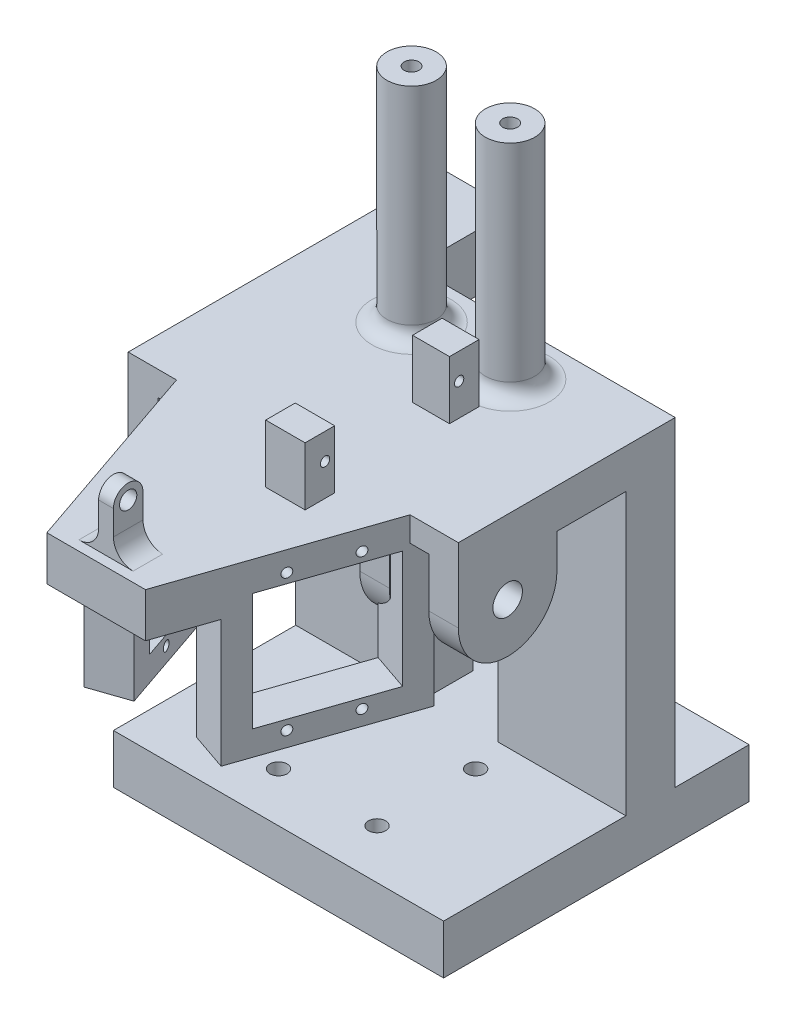
from build123d import *

# Parameters (mm, degrees)
SKETCH_1_W             = 67
SKETCH_1_H             = 62
EXTRUDE_1_DEPTH        = 10
SKETCH_3_W             = 14
SKETCH_3_H             = 20
EXTRUDE_2_DEPTH        = 12.5
SKETCH_4_W             = 10
SKETCH_4_H             = 65
EXTRUDE_3_DEPTH        = 67
SKETCH_5_W             = 67
SKETCH_5_H             = 44
EXTRUDE_4_DEPTH        = 8
EXTRUDE_5_DEPTH        = 20
CUT_EXTRUDE_START      = -6
CUT_EXTRUDE_1_DEPTH    = 8
EXTRUDE_6_DEPTH        = 6
SKETCH_9_R             = 3
CUT_EXTRUDE_2_DEPTH    = 23
SKETCH_10_W            = 24
SKETCH_10_H            = 23.8
EXTRUDE_7_DEPTH        = 8
SKETCH_12_W            = 14
SKETCH_12_H            = 20
EXTRUDE_8_DEPTH        = 11.5
SKETCH_13_R            = 0.95
CUT_EXTRUDE_4_DEPTH    = 8
SKETCH_14_W            = 7.5
SKETCH_14_H            = 6
SKETCH_14_W_2          = 8
EXTRUDE_9_DEPTH        = 11.8
SKETCH_15_R            = 0.95
CUT_EXTRUDE_5_DEPTH    = 11.8
SKETCH_16_W            = 3
SKETCH_16_H            = 6
EXTRUDE_10_DEPTH       = 12
FILLET_1_RADIUS        = 3
FILLET_1_LENGTH        = 3
SKETCH_17_R            = 1.75
CUT_EXTRUDE_6_DEPTH    = 7
SKETCH_18_R            = 5
EXTRUDE_11_DEPTH       = 45
FILLET_2_R             = 3
FILLET_2_OF_MIRROR_1_R = 3
SKETCH_20_R            = 1.75
CUT_EXTRUDE_7_DEPTH    = 35
SKETCH_21_W            = 15
SKETCH_21_H            = 55
CUT_EXTRUDE_8_DEPTH    = 35
SKETCH_24_R            = 1.75
CUT_EXTRUDE_11_DEPTH   = 18
SKETCH_25_R            = 1.5
CUT_EXTRUDE_12_DEPTH   = 10
FILLET_3_R             = 4
EXTRUDE_12_DEPTH       = 3
SKETCH_27_W            = 9.9
SKETCH_27_H            = 3.8
EXTRUDE_13_DEPTH       = 1
SKETCH_29_R            = 1.4
CUT_EXTRUDE_13_DEPTH   = 4


with BuildPart() as part:
    # 草图1 → 凸台-拉伸1 (new body)
    with BuildSketch(Plane(origin=(0, 0, 0), x_dir=(1, 0, 0), z_dir=(0, 1, 0))):
        Rectangle(SKETCH_1_W, SKETCH_1_H)
    extrude(amount=EXTRUDE_1_DEPTH)

    # 草图3 → 凸台-拉伸2 (add)
    with BuildSketch(Plane(origin=(0, 10, 0), x_dir=(1, 0, 0), z_dir=(0, 1, 0))):
        with Locations((-26.5, 26)):
            Rectangle(SKETCH_3_W, SKETCH_3_H)
    extrude(amount=EXTRUDE_2_DEPTH)

    # 草图4 → 凸台-拉伸3 (add)
    with BuildSketch(Plane.ZY.offset(33.5)):
        with Locations((-11, 42.5)):
            Rectangle(SKETCH_4_W, SKETCH_4_H)
    extrude(amount=-EXTRUDE_3_DEPTH)

    # 草图5 → 凸台-拉伸4 (add)
    with BuildSketch(Plane(origin=(0, 75, 0), x_dir=(1, 0, 0), z_dir=(0, 1, 0))):
        with Locations((0, -6)):
            Rectangle(SKETCH_5_W, SKETCH_5_H)
    extrude(amount=-EXTRUDE_4_DEPTH)

    # 草图6 → 凸台-拉伸5 (add)
    with BuildSketch(Plane(origin=(33.5, 0, 0), x_dir=(0, 0, -1), z_dir=(1, 0, 0))):
        with BuildLine():
            Line((-28, 60), (-28, 67))
            Line((-28, 67), (-8, 67))
            Line((-8, 67), (-8, 60))
            ThreePointArc((-8, 60), (-18, 50), (-28, 60))
        make_face()
    extrude_5 = extrude(amount=-EXTRUDE_5_DEPTH)

    # 草图7 → 切除-拉伸1 (cut)
    with BuildSketch(Plane(origin=(33.5, 0, 0), x_dir=(0, 0, -1), z_dir=(1, 0, 0)).offset(CUT_EXTRUDE_START)):
        with BuildLine():
            Line((-28, 60), (-28, 70.000230089))
            Line((-28, 70.000230089), (-8, 70.000230089))
            Line((-8, 70.000230089), (-8, 60))
            ThreePointArc((-8, 60), (-18, 50), (-28, 60))
        make_face()
    cut_extrude_1 = extrude(amount=-CUT_EXTRUDE_1_DEPTH, mode=Mode.SUBTRACT)

    # 草图8 → 凸台-拉伸6 (add)
    with BuildSketch(Plane(origin=(0, 75, 0), x_dir=(1, 0, 0), z_dir=(0, 1, 0))):
        Polygon((0, -68), (10, -68), (23.694211345, -28), (0, -28), align=None)
    extrude_6 = extrude(amount=-EXTRUDE_6_DEPTH)

    # 草图9 → 切除-拉伸2 (cut)
    with BuildSketch(Plane(origin=(33.5, 0, 0), x_dir=(0, 0, -1), z_dir=(1, 0, 0))):
        with Locations((-18, 60)):
            Circle(SKETCH_9_R)
    cut_extrude_2 = extrude(amount=-CUT_EXTRUDE_2_DEPTH, mode=Mode.SUBTRACT)

    # 草图10 → 凸台-拉伸7 (add)
    with BuildSketch(Plane(origin=(29.7887098, 0, 10.198322192), x_dir=(0.32389942978753467, 0, -0.9460915174460186), z_dir=(0.9460915174460186, 0, 0.32389942978753467))):
        Polygon((-44, 75), (-15, 75), (-15, 40.2), (-43, 40.2), (-49, 40.2), (-49, 75), align=None)
        with Locations((-32, 57.1)):
            Rectangle(SKETCH_10_W, SKETCH_10_H, mode=Mode.SUBTRACT)
    extrude_7 = extrude(amount=-EXTRUDE_7_DEPTH)

    # 草图12 → 凸台-拉伸8 (add)
    with BuildSketch(Plane(origin=(0, 75, 0), x_dir=(1, 0, 0), z_dir=(0, 1, 0))):
        with Locations((-26.5, 26)):
            Rectangle(SKETCH_12_W, SKETCH_12_H)
    extrude(amount=-EXTRUDE_8_DEPTH)

    # 草图13 → 切除-拉伸4 (cut)
    with BuildSketch(Plane(origin=(22.21997766, 0, 7.607126754), x_dir=(-0.3238994297875346, 0, 0.9460915174460185), z_dir=(-0.9460915174460185, 0, -0.3238994297875346))):
        with Locations((38.5, 70.95)):
            Circle(SKETCH_13_R)
        with Locations((26.5, 70.95)):
            Circle(SKETCH_13_R)
        with Locations((26.5, 43.25)):
            Circle(SKETCH_13_R)
        with Locations((38.5, 43.25)):
            Circle(SKETCH_13_R)
    cut_extrude_4 = extrude(amount=-CUT_EXTRUDE_4_DEPTH, mode=Mode.SUBTRACT)

    # 草图14 → 凸台-拉伸9 (add)
    with BuildSketch(Plane(origin=(0, 75, 0), x_dir=(1, 0, 0), z_dir=(0, 1, 0))):
        with Locations((7.95, -5)):
            Rectangle(SKETCH_14_W, SKETCH_14_H)
        with Locations((8.2, -34.8)):
            Rectangle(SKETCH_14_W_2, SKETCH_14_H)
    extrude(amount=EXTRUDE_9_DEPTH)

    # 草图15 → 切除-拉伸5 (cut)
    with BuildSketch(Plane.ZY.offset(-4.2)):
        with Locations((33.75, 81.5)):
            Circle(SKETCH_15_R)
        with Locations((6.05, 81.5)):
            Circle(SKETCH_15_R)
    extrude(amount=-CUT_EXTRUDE_5_DEPTH, mode=Mode.SUBTRACT)

    # 草图16 → 凸台-拉伸10 (add)
    with BuildSketch(Plane(origin=(0, 75, 0), x_dir=(1, 0, 0), z_dir=(0, 1, 0))):
        with Locations((0, -63)):
            Rectangle(SKETCH_16_W, SKETCH_16_H)
    extrude(amount=EXTRUDE_10_DEPTH)

    # 圆角1: full round fillet: the end face becomes a half cylinder, R = half its width
    fillet_1_face = Plane((0, 87, 63), x_dir=(1, 0, 0), z_dir=(0, 1, 0))  # on the end face: x along it, z out of the body
    fillet_1_slab = fillet_1_face.offset(-FILLET_1_RADIUS / 2) * Box(FILLET_1_LENGTH, 2 * FILLET_1_RADIUS, FILLET_1_RADIUS, mode=Mode.PRIVATE)  # the body's end, R deep
    fillet_1_round = Plane((0, 84, 63), x_dir=(0, 1, 0), z_dir=(1, 0, 0)) * Cylinder(FILLET_1_RADIUS, FILLET_1_LENGTH, mode=Mode.PRIVATE)  # its axis R under the face
    add(fillet_1_slab - fillet_1_round, mode=Mode.SUBTRACT)

    # 草图17 → 切除-拉伸6 (cut)
    with BuildSketch(Plane.ZY.offset(1.5)):
        with Locations((63, 84)):
            Circle(SKETCH_17_R)
    extrude(amount=-CUT_EXTRUDE_6_DEPTH, mode=Mode.SUBTRACT)

    # 草图18 → 凸台-拉伸11 (add)
    with BuildSketch(Plane(origin=(0, 75, 0), x_dir=(1, 0, 0), z_dir=(0, 1, 0))):
        with Locations(Location((10, 6, 0), (0, 0, 90))):
            Circle(SKETCH_18_R)
    extrude_11 = extrude(amount=EXTRUDE_11_DEPTH)

    # 圆角2
    fillet_2_edges = [part.edges().sort_by_distance(p)[0] for p in [
        (10, 75, -1),
    ]]
    fillet(fillet_2_edges, radius=FILLET_2_R - 0.0001)  # a hair under: the kernel refuses the full size

    # 镜向1: 凸台-拉伸5, 切除-拉伸1, 凸台-拉伸6, 切除-拉伸2, 凸台-拉伸7, 切除-拉伸4, 凸台-拉伸11 across plane
    add(extrude_5.mirror(Plane(origin=(0, 0, 0), x_dir=(0, 0, 1), z_dir=(1, 0, 0))))
    add(cut_extrude_1.mirror(Plane(origin=(0, 0, 0), x_dir=(0, 0, 1), z_dir=(1, 0, 0))), mode=Mode.SUBTRACT)
    add(extrude_6.mirror(Plane(origin=(0, 0, 0), x_dir=(0, 0, 1), z_dir=(1, 0, 0))))
    add(cut_extrude_2.mirror(Plane(origin=(0, 0, 0), x_dir=(0, 0, 1), z_dir=(1, 0, 0))), mode=Mode.SUBTRACT)
    add(extrude_7.mirror(Plane(origin=(0, 0, 0), x_dir=(0, 0, 1), z_dir=(1, 0, 0))))
    add(cut_extrude_4.mirror(Plane(origin=(0, 0, 0), x_dir=(0, 0, 1), z_dir=(1, 0, 0))), mode=Mode.SUBTRACT)
    add(extrude_11.mirror(Plane(origin=(0, 0, 0), x_dir=(0, 0, 1), z_dir=(1, 0, 0))))

    # 圆角2 of 镜向1
    fillet_2_of_mirror_1_edges = [part.edges().sort_by_distance(p)[0] for p in [
        (-10, 75, -1),
    ]]
    fillet(fillet_2_of_mirror_1_edges, radius=FILLET_2_OF_MIRROR_1_R - 0.0001)  # a hair under: the kernel refuses the full size

    # 草图20 → 切除-拉伸7 (cut)
    with BuildSketch(Plane.ZY.offset(33.5)):
        with Locations((-31, 67)):
            Circle(SKETCH_20_R)
        with Locations((-21, 67)):
            Circle(SKETCH_20_R)
        with Locations((-31, 19)):
            Circle(SKETCH_20_R)
        with Locations((-21, 19)):
            Circle(SKETCH_20_R)
    extrude(amount=-CUT_EXTRUDE_7_DEPTH, mode=Mode.SUBTRACT)

    # 草图21 → 切除-拉伸8 (cut)
    with BuildSketch(Plane(origin=(0, 0, -16), x_dir=(-1, 0, 0), z_dir=(0, 0, -1))):
        with Locations((0, 37.5)):
            Rectangle(SKETCH_21_W, SKETCH_21_H)
    extrude(amount=-CUT_EXTRUDE_8_DEPTH, mode=Mode.SUBTRACT)

    # 草图24 → 切除-拉伸11 (cut)
    with BuildSketch(Plane(origin=(0, 10, 0), x_dir=(1, 0, 0), z_dir=(0, 1, 0))):
        with Locations(Location((-10, -21, 0), (0, 0, 270))):
            Circle(SKETCH_24_R)
        with Locations(Location((10, -21, 0), (0, 0, 270))):
            Circle(SKETCH_24_R)
        with Locations(Location((-10, -1, 0), (0, 0, 270))):
            Circle(SKETCH_24_R)
        with Locations(Location((10, -1, 0), (0, 0, 270))):
            Circle(SKETCH_24_R)
    extrude(amount=-CUT_EXTRUDE_11_DEPTH, mode=Mode.SUBTRACT)

    # 草图25 → 切除-拉伸12 (cut)
    with BuildSketch(Plane(origin=(0, 120, 0), x_dir=(1, 0, 0), z_dir=(0, 1, 0))):
        with Locations(Location((10, 6, 0), (0, 0, 270))):
            Circle(SKETCH_25_R)
        with Locations(Location((-10, 6, 0), (0, 0, 270))):
            Circle(SKETCH_25_R)
    extrude(amount=-CUT_EXTRUDE_12_DEPTH, mode=Mode.SUBTRACT)

    # 圆角3
    fillet_3_edges = [part.edges().sort_by_distance(p)[0] for p in [
        (-1.5, 75, 63),
        (1.5, 75, 63),
    ]]
    fillet(fillet_3_edges, radius=FILLET_3_R)

    # 草图26 → 凸台-拉伸12 (add)
    with BuildSketch(Plane.XZ.offset(-69)):
        Polygon((-6.348905601, 53.965611109), (6.348905601, 53.965611109), (13.91763774, 56.556806547), (10, 68), (-10, 68), (-13.91763774, 56.556806547), align=None)
    extrude(amount=EXTRUDE_12_DEPTH)

    # 草图27 → 凸台-拉伸13 (add)
    with BuildSketch(Plane.XZ.offset(-66)):
        with Locations((0, 62)):
            Rectangle(SKETCH_27_W, SKETCH_27_H)
    extrude(amount=EXTRUDE_13_DEPTH)

    # 草图29 → 切除-拉伸13 (cut)
    with BuildSketch(Plane.XZ.offset(-65)):
        with Locations(Location((0, 62, 0), (0, 0, 270))):
            Circle(SKETCH_29_R)
    extrude(amount=-CUT_EXTRUDE_13_DEPTH, mode=Mode.SUBTRACT)


solid = part.part
